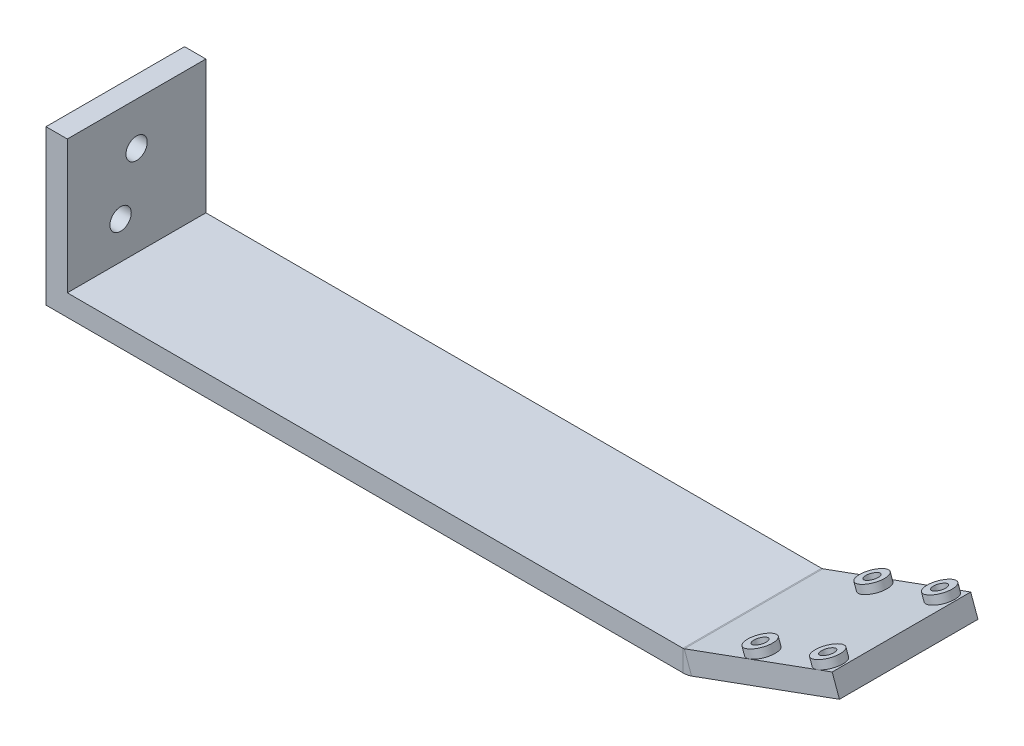
from build123d import *

# Parameters (mm, degrees)
ESQUISSE2_W                 = 150
ESQUISSE2_H                 = 26
T_LE_DE_BASE_PLI_E1_DEPTH   = 4
PLI_START                   = -13
PLI_ESQUISS_1_DEPTH         = 26
PLI_ESQUISS_1_2_DEPTH       = 26
ESQUISSE9_R                 = 2.5
ESQUISSE9_R_2               = 1.25
BOSS_EXTRU_1_DEPTH          = 1.5
ENL_V_START                 = -4
ENL_V_MAT_EXTRU_1_OUTLINE_R = 1.25
ENL_V_MAT_EXTRU_1_DEPTH     = 4
ESQUISSE11_W                = 4
ESQUISSE11_H                = 26
BOSS_EXTRU_2_DEPTH          = 25
ESQUISSE12_R                = 2
ENL_V_MAT_EXTRU_5_DEPTH     = 148.599026321


# Read off the part's stored shape, not the designer's step: Pli esquissé1, Enlèv. mat.-Extru.1
# Sheet-metal steps are written as plain solids
with BuildPart() as part:
    # Esquisse2 → Tôle de base pliée1 (new body)
    with BuildSketch(Plane(origin=(0, 0, 0), x_dir=(1, 0, 0), z_dir=(0, 1, 0))):
        Rectangle(ESQUISSE2_W, ESQUISSE2_H)
    extrude(amount=-T_LE_DE_BASE_PLI_E1_DEPTH)

    # Pli esquissé1 outline → Pli esquissé1 (cut)
    with BuildSketch(Plane.XY.offset(PLI_START)):
        with BuildLine():
            Line((75, 0), (56.347473252, 0))
            Line((56.347473252, 0), (46.142385808, -3.714348068))
            ThreePointArc((46.142385808, -3.714348068), (45.344875155, -3.928040403), (44.522373197, -4))
            Line((44.522373197, -4), (75, -4))
            Line((75, -4), (75, 0))
        make_face()
    extrude(amount=PLI_ESQUISS_1_DEPTH, mode=Mode.SUBTRACT)

    # Pli esquiss_1 2 outline → Pli esquiss_1 2 (add)
    with BuildSketch(Plane.XY.offset(PLI_START)):
        with BuildLine():
            Line((56.347473252, 0), (73.884342049, 6.382898245))
            Line((73.884342049, 6.382898245), (72.516261476, 10.141668728))
            Line((72.516261476, 10.141668728), (44.774305234, 0.044422416))
            ThreePointArc((44.774305234, 0.044422416), (44.650282444, 0.011190609), (44.522373197, 0))
            Line((44.522373197, 0), (56.347473252, 0))
        make_face()
    extrude(amount=PLI_ESQUISS_1_2_DEPTH)

    # Esquisse9 → Boss.-Extru.1 (add)
    # profile 1 of 4: a face of its own
    with BuildSketch(Plane(origin=(5.223321668, -14.350958338, 0), x_dir=(0.9396926207859082, 0.34202014332566943, 0), z_dir=(-0.34202014332566943, 0.9396926207859082, 0))):
        with Locations(Location((55.111650787, 10.5, 0), (0, 0, 90))):
            Circle(ESQUISSE9_R)
        with Locations(Location((55.111650787, 10.5, 0), (0, 0, 180))):
            Circle(ESQUISSE9_R_2, mode=Mode.SUBTRACT)
    # profile 2 of 4: a face of its own
    with BuildSketch(Plane(origin=(5.223321668, -14.350958338, 0), x_dir=(0.9396926207859082, 0.34202014332566943, 0), z_dir=(-0.34202014332566943, 0.9396926207859082, 0))):
        with Locations(Location((68.611650787, 10.5, 0), (0, 0, 90))):
            Circle(ESQUISSE9_R)
        with Locations(Location((68.611650787, 10.5, 0), (0, 0, 180))):
            Circle(ESQUISSE9_R_2, mode=Mode.SUBTRACT)
    # profile 3 of 4: a face of its own
    with BuildSketch(Plane(origin=(5.223321668, -14.350958338, 0), x_dir=(0.9396926207859082, 0.34202014332566943, 0), z_dir=(-0.34202014332566943, 0.9396926207859082, 0))):
        with Locations((68.611650787, -10.5)):
            Circle(ESQUISSE9_R)
        with Locations((68.611650787, -10.5)):
            Circle(ESQUISSE9_R_2, mode=Mode.SUBTRACT)
    # profile 4 of 4: a face of its own
    with BuildSketch(Plane(origin=(5.223321668, -14.350958338, 0), x_dir=(0.9396926207859082, 0.34202014332566943, 0), z_dir=(-0.34202014332566943, 0.9396926207859082, 0))):
        with Locations((55.111650787, -10.5)):
            Circle(ESQUISSE9_R)
        with Locations((55.111650787, -10.5)):
            Circle(ESQUISSE9_R_2, mode=Mode.SUBTRACT)
    extrude(amount=BOSS_EXTRU_1_DEPTH)

    # Enlèv. mat.-Extru.1 outline → Enlèv. mat.-Extru.1 (cut)
    with BuildSketch(Plane(origin=(5.223321668, -14.350958338, 0), x_dir=(0.9396926207859082, 0.34202014332566943, 0), z_dir=(-0.34202014332566943, 0.9396926207859082, 0)).offset(ENL_V_START)):
        with Locations((68.611650787, 10.5)):
            Circle(ENL_V_MAT_EXTRU_1_OUTLINE_R)
        with Locations((68.611650787, -10.5)):
            Circle(ENL_V_MAT_EXTRU_1_OUTLINE_R)
        with Locations((55.111650787, 10.5)):
            Circle(ENL_V_MAT_EXTRU_1_OUTLINE_R)
        with Locations((55.111650787, -10.5)):
            Circle(ENL_V_MAT_EXTRU_1_OUTLINE_R)
    extrude(amount=ENL_V_MAT_EXTRU_1_DEPTH, mode=Mode.SUBTRACT)

    # Esquisse11 → Boss.-Extru.2 (add)
    with BuildSketch(Plane(origin=(0, 0, 0), x_dir=(1, 0, 0), z_dir=(0, 1, 0))):
        with Locations((-73, 0)):
            Rectangle(ESQUISSE11_W, ESQUISSE11_H)
    extrude(amount=BOSS_EXTRU_2_DEPTH)

    # Esquisse12 → Enlèv. mat.-Extru.5 (cut, through all)
    with BuildSketch(Plane(origin=(-71, 0, 0), x_dir=(0, 0, -1), z_dir=(1, 0, 0))):
        with Locations((-3, 7)):
            Circle(ESQUISSE12_R)
        with Locations((0, 17)):
            Circle(ESQUISSE12_R)
    extrude(amount=-ENL_V_MAT_EXTRU_5_DEPTH, mode=Mode.SUBTRACT)


solid = part.part
